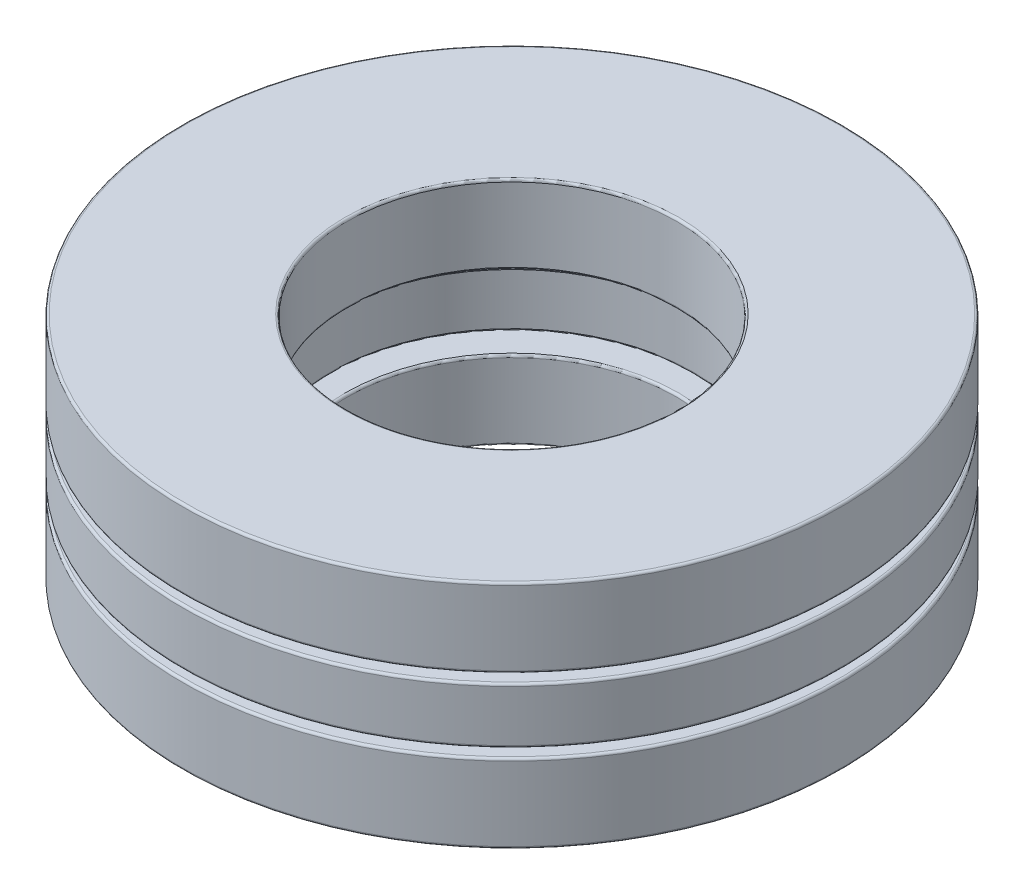
from build123d import *

# Parameters (mm, degrees)
CIRPATTERN2_COUNT = 16
CIRPATTERN3_COUNT = 16


with BuildPart() as part:
    # Sketch2 → Revolve2 (revolve)
    with BuildSketch(Plane.XY):
        with BuildLine():
            Line((-11, -1.55375), (-11, 1.55375))
            ThreePointArc((-11, 1.55375), (-11.041005051, 1.652744949), (-11.14, 1.69375))
            Line((-11.14, 1.69375), (-19.86, 1.69375))
            ThreePointArc((-19.86, 1.69375), (-19.958994949, 1.652744949), (-20, 1.55375))
            Line((-20, 1.55375), (-20, -1.55375))
            ThreePointArc((-20, -1.55375), (-19.958994949, -1.652744949), (-19.86, -1.69375))
            Line((-19.86, -1.69375), (-11.14, -1.69375))
            ThreePointArc((-11.14, -1.69375), (-11.041005051, -1.652744949), (-11, -1.55375))
        make_face()
    revolve(axis=Axis((0, -7, 0), (0, 1, 0)))

    # Sketch3 → Cut-Revolve1 (revolve, cut)
    with BuildSketch(Plane.XY):
        with BuildLine():
            Line((-15.5, 2.7725), (-15.5, -2.7725))
            ThreePointArc((-15.5, -2.7725), (-18.2725, 0), (-15.5, 2.7725))
        make_face()
    cut_revolve1 = revolve(axis=Axis((-15.5, 2.7725, 0), (0, -1, 0)), mode=Mode.SUBTRACT)

    # CirPattern2: Cut-Revolve1 ×16 about axis
    cirpattern2_axis = Axis((0, -7, 0), (0, 1, 0))
    for i in range(1, CIRPATTERN2_COUNT):
        add(cut_revolve1.rotate(cirpattern2_axis, i * 360 / CIRPATTERN2_COUNT), mode=Mode.SUBTRACT)


with BuildPart() as body_2:
    # Sketch4 → Revolve3 (revolve)
    with BuildSketch(Plane.XY):
        with BuildLine():
            Line((-19.86, 2.233125), (-17.143139977, 2.233125))
            ThreePointArc((-17.143139977, 2.233125), (-15.5, 2.7725), (-13.856860023, 2.233125))
            Line((-13.856860023, 2.233125), (-10.14, 2.233125))
            ThreePointArc((-10.14, 2.233125), (-10.041005051, 2.274130051), (-10, 2.373125))
            Line((-10, 2.373125), (-10, 6.86))
            ThreePointArc((-10, 6.86), (-10.041005051, 6.958994949), (-10.14, 7))
            Line((-10.14, 7), (-19.86, 7))
            ThreePointArc((-19.86, 7), (-19.958994949, 6.958994949), (-20, 6.86))
            Line((-20, 6.86), (-20, 2.373125))
            ThreePointArc((-20, 2.373125), (-19.958994949, 2.274130051), (-19.86, 2.233125))
        make_face()
    revolve(axis=Axis((0, -7, 0), (0, 1, 0)))


with BuildPart() as body_3:
    # Mirror1: mirrored copy
    add(body_2.part.mirror(Plane.ZX))


with BuildPart() as body_4:
    # Sketch5 → Revolve4 (revolve)
    with BuildSketch(Plane.XY):
        with BuildLine():
            Line((-15.5, 2.71), (-15.5, -2.71))
            ThreePointArc((-15.5, -2.71), (-18.21, 0), (-15.5, 2.71))
        make_face()
    revolve(axis=Axis((-15.5, 2.71, 0), (0, -1, 0)))


with BuildPart() as cirpattern3_1:
    # CirPattern3: pattern copy
    add(body_4.part.rotate(Axis((0, -7, 0), (0, 1, 0)), 1 * 360 / CIRPATTERN3_COUNT))


with BuildPart() as cirpattern3_2:
    # CirPattern3: pattern copy
    add(body_4.part.rotate(Axis((0, -7, 0), (0, 1, 0)), 2 * 360 / CIRPATTERN3_COUNT))


with BuildPart() as cirpattern3_3:
    # CirPattern3: pattern copy
    add(body_4.part.rotate(Axis((0, -7, 0), (0, 1, 0)), 3 * 360 / CIRPATTERN3_COUNT))


with BuildPart() as cirpattern3_4:
    # CirPattern3: pattern copy
    add(body_4.part.rotate(Axis((0, -7, 0), (0, 1, 0)), 4 * 360 / CIRPATTERN3_COUNT))


with BuildPart() as cirpattern3_5:
    # CirPattern3: pattern copy
    add(body_4.part.rotate(Axis((0, -7, 0), (0, 1, 0)), 5 * 360 / CIRPATTERN3_COUNT))


with BuildPart() as cirpattern3_6:
    # CirPattern3: pattern copy
    add(body_4.part.rotate(Axis((0, -7, 0), (0, 1, 0)), 6 * 360 / CIRPATTERN3_COUNT))


with BuildPart() as cirpattern3_7:
    # CirPattern3: pattern copy
    add(body_4.part.rotate(Axis((0, -7, 0), (0, 1, 0)), 7 * 360 / CIRPATTERN3_COUNT))


with BuildPart() as cirpattern3_8:
    # CirPattern3: pattern copy
    add(body_4.part.rotate(Axis((0, -7, 0), (0, 1, 0)), 8 * 360 / CIRPATTERN3_COUNT))


with BuildPart() as cirpattern3_9:
    # CirPattern3: pattern copy
    add(body_4.part.rotate(Axis((0, -7, 0), (0, 1, 0)), 9 * 360 / CIRPATTERN3_COUNT))


with BuildPart() as cirpattern3_10:
    # CirPattern3: pattern copy
    add(body_4.part.rotate(Axis((0, -7, 0), (0, 1, 0)), 10 * 360 / CIRPATTERN3_COUNT))


with BuildPart() as cirpattern3_11:
    # CirPattern3: pattern copy
    add(body_4.part.rotate(Axis((0, -7, 0), (0, 1, 0)), 11 * 360 / CIRPATTERN3_COUNT))


with BuildPart() as cirpattern3_12:
    # CirPattern3: pattern copy
    add(body_4.part.rotate(Axis((0, -7, 0), (0, 1, 0)), 12 * 360 / CIRPATTERN3_COUNT))


with BuildPart() as cirpattern3_13:
    # CirPattern3: pattern copy
    add(body_4.part.rotate(Axis((0, -7, 0), (0, 1, 0)), 13 * 360 / CIRPATTERN3_COUNT))


with BuildPart() as cirpattern3_14:
    # CirPattern3: pattern copy
    add(body_4.part.rotate(Axis((0, -7, 0), (0, 1, 0)), 14 * 360 / CIRPATTERN3_COUNT))


with BuildPart() as cirpattern3_15:
    # CirPattern3: pattern copy
    add(body_4.part.rotate(Axis((0, -7, 0), (0, 1, 0)), 15 * 360 / CIRPATTERN3_COUNT))


solid = Compound([part.part, body_2.part, body_3.part, body_4.part, cirpattern3_1.part, cirpattern3_2.part, cirpattern3_3.part, cirpattern3_4.part, cirpattern3_5.part, cirpattern3_6.part, cirpattern3_7.part, cirpattern3_8.part, cirpattern3_9.part, cirpattern3_10.part, cirpattern3_11.part, cirpattern3_12.part, cirpattern3_13.part, cirpattern3_14.part, cirpattern3_15.part])
